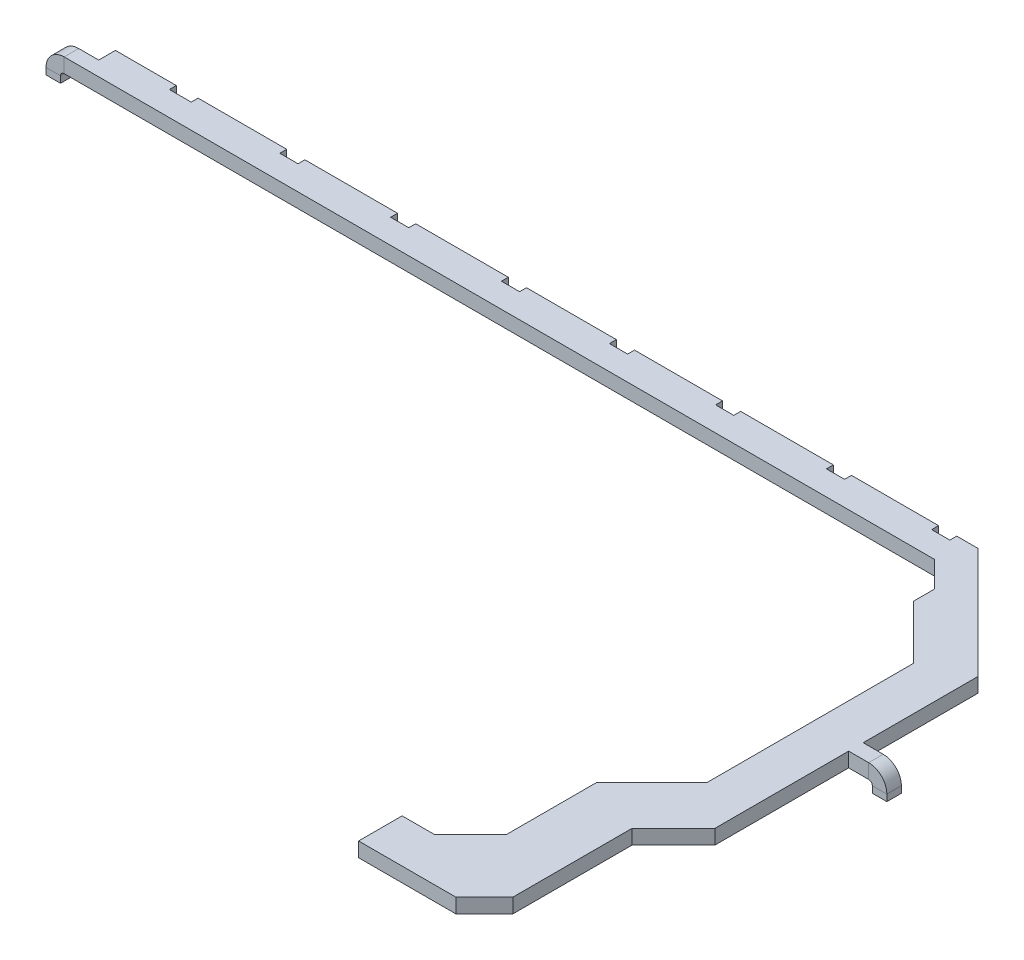
from build123d import *

# Parameters (mm, degrees)
BOSS_EXTRUDE1_DEPTH = 2
EDGE_FLANGE1_DEPTH  = 2
EDGE_FLANGE2_DEPTH  = 2
SKETCH13_W          = 2.5
SKETCH13_H          = 2.15
SKETCH13_W_2        = 3
CUT_EXTRUDE3_DEPTH  = 10


# Sheet-metal steps are written as plain solids
with BuildPart() as part:
    # Sketch2 → Boss-Extrude1 (new body)
    with BuildSketch(Plane(origin=(0, 0, 0), x_dir=(1, 0, 0), z_dir=(0, 1, 0))):
        Polygon((-52.543309772, 32.413356753), (-54.793309772, 32.413356753), (-54.793309772, 30.413356753), (64.413548219, 30.413356753), (67.959993108, 26.866911863), (67.959993108, 23.966910068), (75.359993548, 16.566912168), (75.359993548, -11.849150158), (67.759993508, -19.449150198), (67.759993508, -31.745752353), (62.750836838, -36.754909023), (58.359994528, -36.754909023), (58.359994528, -42.739906444), (71.753176861, -42.739906444), (75.659994488, -38.833088817), (75.659994488, -22.433088597), (81.359993248, -16.733089837), (81.359993248, 1.669814581), (83.609993248, 1.669814581), (83.609993248, 3.669814581), (81.359993248, 3.669814581), (81.359993248, 19.459804242), (66.106440177, 34.713357313), (-52.543309772, 34.713357313), align=None)
    extrude(amount=BOSS_EXTRUDE1_DEPTH)

    # Edge-Flange1 section (across the edge) → Edge-Flange1 (add)
    with BuildSketch(Plane(origin=(-55.793309772, 0, -30.413356753), x_dir=(1, 0, 0), z_dir=(0, 0, -1))):
        with BuildLine():
            Line((-2, 0.5), (-2, 1.4))
            Line((-2, 1.4), (0, 1.4))
            Line((0, 1.4), (0, 0.5))
            ThreePointArc((0, 0.5), (0.146446609, 0.146446609), (0.5, 0))
            Line((0.5, 0), (1, 0))
            Line((1, 0), (1, -2))
            Line((1, -2), (0.5, -2))
            ThreePointArc((0.5, -2), (-1.267766953, -1.267766953), (-2, 0.5))
        make_face()
    extrude(amount=EDGE_FLANGE1_DEPTH)

    # Edge-Flange2 section (across the edge) → Edge-Flange2 (add)
    with BuildSketch(Plane(origin=(84.609993248, 0, -3.669814581), x_dir=(-1, 0, 0), z_dir=(0, 0, 1))):
        with BuildLine():
            Line((-2, 0.5), (-2, 1.4))
            Line((-2, 1.4), (0, 1.4))
            Line((0, 1.4), (0, 0.5))
            ThreePointArc((0, 0.5), (0.146446609, 0.146446609), (0.5, 0))
            Line((0.5, 0), (1, 0))
            Line((1, 0), (1, -2))
            Line((1, -2), (0.5, -2))
            ThreePointArc((0.5, -2), (-1.267766953, -1.267766953), (-2, 0.5))
        make_face()
    extrude(amount=EDGE_FLANGE2_DEPTH)

    # Sketch13 → Cut-Extrude3 (cut)
    with BuildSketch(Plane(origin=(0, 2, 0), x_dir=(1, 0, 0), z_dir=(0, 1, 0))):
        with Locations((-27.730006168, 34.839358373)):
            Rectangle(SKETCH13_W, SKETCH13_H)
        with Locations((-42.672006168, 34.839358373)):
            Rectangle(SKETCH13_W_2, SKETCH13_H)
        with Locations((-12.490006168, 34.839358373)):
            Rectangle(SKETCH13_W, SKETCH13_H)
        with Locations((2.749993832, 34.839358373)):
            Rectangle(SKETCH13_W, SKETCH13_H)
        with Locations((17.608993832, 34.839358373)):
            Rectangle(SKETCH13_W, SKETCH13_H)
        with Locations((32.213993832, 34.839358373)):
            Rectangle(SKETCH13_W, SKETCH13_H)
        with Locations((47.453993832, 34.839358373)):
            Rectangle(SKETCH13_W, SKETCH13_H)
        with Locations((61.931993832, 34.839358373)):
            Rectangle(SKETCH13_W, SKETCH13_H)
    extrude(amount=-CUT_EXTRUDE3_DEPTH, mode=Mode.SUBTRACT)


solid = part.part
